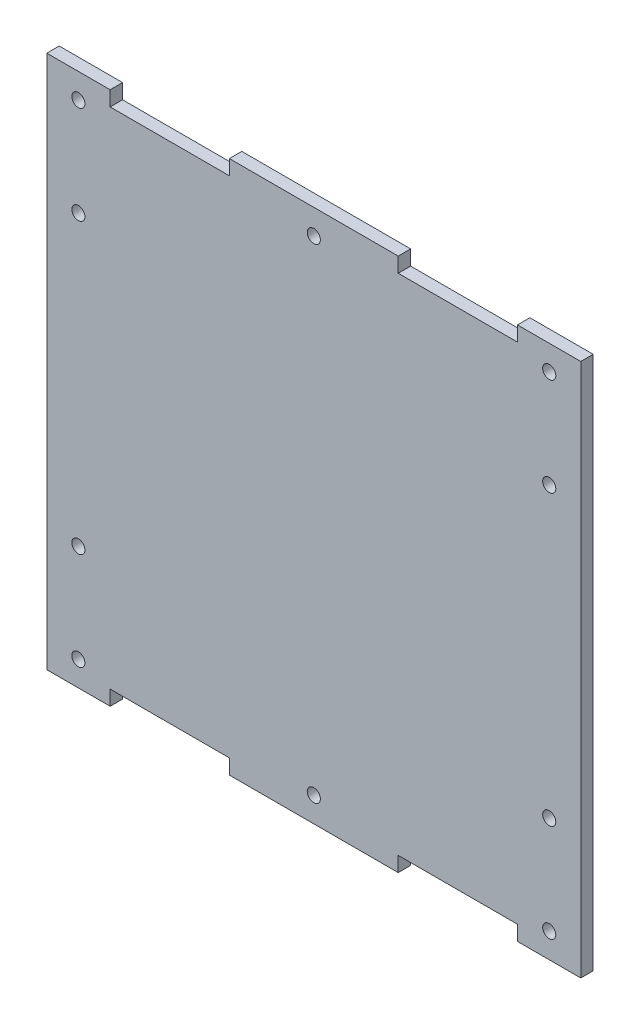
from build123d import *

# Parameters (mm, degrees)
SKETCH2_W           = 273.05
SKETCH2_H           = 273.05
SKETCH2_R           = 3.35
BOSS_EXTRUDE1_DEPTH = 6.35
SKETCH3_W           = 60.96
SKETCH3_H           = 17.280059867
CUT_EXTRUDE1_DEPTH  = 194.179899964


with BuildPart() as part:
    # Sketch2 → Boss-Extrude1 (new body)
    with BuildSketch(Plane.XY):
        Rectangle(SKETCH2_W, SKETCH2_H)
        with Locations((-120.396, 123.825)):
            Circle(SKETCH2_R, mode=Mode.SUBTRACT)
        with Locations((-120.396, 73.787)):
            Circle(SKETCH2_R, mode=Mode.SUBTRACT)
        with Locations((0, 123.825)):
            Circle(SKETCH2_R, mode=Mode.SUBTRACT)
        with Locations((120.396, 73.787)):
            Circle(SKETCH2_R, mode=Mode.SUBTRACT)
        with Locations((120.396, 123.825)):
            Circle(SKETCH2_R, mode=Mode.SUBTRACT)
        with Locations((120.396, -123.825)):
            Circle(SKETCH2_R, mode=Mode.SUBTRACT)
        with Locations((120.396, -73.787)):
            Circle(SKETCH2_R, mode=Mode.SUBTRACT)
        with Locations((0, -123.825)):
            Circle(SKETCH2_R, mode=Mode.SUBTRACT)
        with Locations((-120.396, -73.787)):
            Circle(SKETCH2_R, mode=Mode.SUBTRACT)
        with Locations((-120.396, -123.825)):
            Circle(SKETCH2_R, mode=Mode.SUBTRACT)
    extrude(amount=BOSS_EXTRUDE1_DEPTH)

    # Sketch3 → Cut-Extrude1 (cut, through all)
    with BuildSketch(Plane.XY.offset(6.35)):
        with Locations((73.66, 137.545029934)):
            Rectangle(SKETCH3_W, SKETCH3_H)
        with Locations((-73.66, 137.545029934)):
            Rectangle(SKETCH3_W, SKETCH3_H)
        with Locations((-73.66, -137.545029934)):
            Rectangle(SKETCH3_W, SKETCH3_H)
        with Locations((73.66, -137.545029934)):
            Rectangle(SKETCH3_W, SKETCH3_H)
    extrude(amount=-CUT_EXTRUDE1_DEPTH, mode=Mode.SUBTRACT)


solid = part.part
